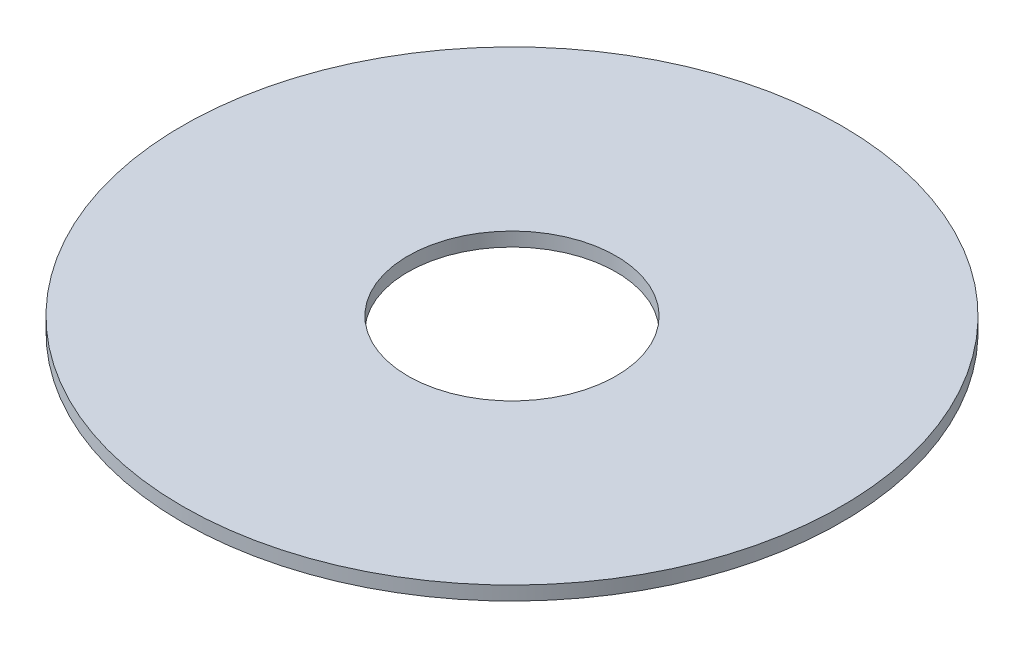
from build123d import *

# Parameters (mm, degrees)
SKETCH1_R           = 95
BOSS_EXTRUDE1_DEPTH = 4
SKETCH2_R           = 30
CUT_EXTRUDE1_DEPTH  = 135.40982107


with BuildPart() as part:
    # Sketch1 → Boss-Extrude1 (new body)
    with BuildSketch(Plane(origin=(0, 0, 0), x_dir=(1, 0, 0), z_dir=(0, 1, 0))):
        Circle(SKETCH1_R)
    extrude(amount=BOSS_EXTRUDE1_DEPTH)

    # Sketch2 → Cut-Extrude1 (cut, through all)
    with BuildSketch(Plane(origin=(0, 0, 0), x_dir=(1, 0, 0), z_dir=(0, 1, 0))):
        Circle(SKETCH2_R)
    extrude(amount=CUT_EXTRUDE1_DEPTH, mode=Mode.SUBTRACT)


solid = part.part
